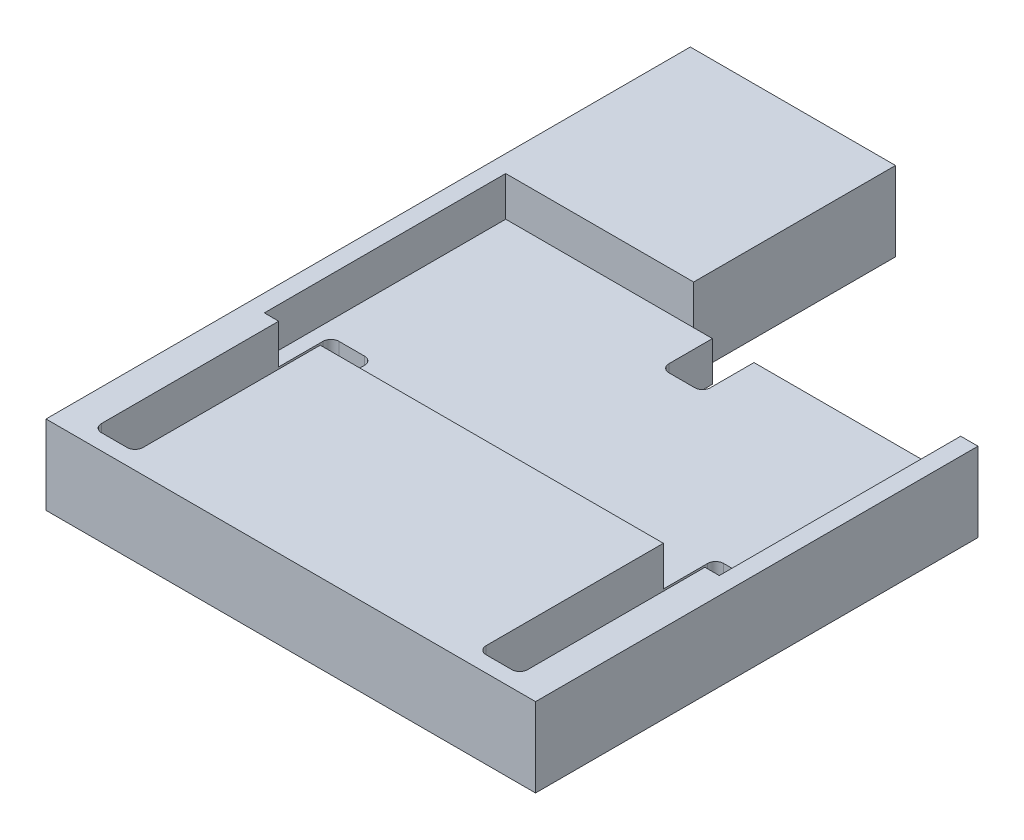
from build123d import *

# Parameters (mm, degrees)
BOSS_EXTRUDE5_DEPTH = 10
CUT_EXTRUDE6_DEPTH  = 5
FILLET4_R           = 1
MIRROR25_DEPTH      = 10
MIRROR25_2_DEPTH    = 5
SKETCH20_W          = 35.925
SKETCH20_H          = 25.502594227
CUT_EXTRUDE7_DEPTH  = 10


# Read off the part's stored shape, not the designer's step: Mirror25
with BuildPart() as part:
    # Sketch15 → Boss-Extrude5 (new body)
    with BuildSketch(Plane(origin=(0, 0, 0), x_dir=(1, 0, 0), z_dir=(0, 1, 0))):
        Polygon((24.3, 76.900659127), (-6.625, 76.900659127), (-6.625, -4.5), (24.3, -4.5), (24.3, 44.900659127), (21.675, 44.900659127), (21.675, 47.400659127), (21.675, 72.400659127), (21.675, 74.900659127), (24.3, 74.900659127), align=None)
        Polygon((-2.625, 25), (-2.625, 0), (-2.625, -2.5), (0, -2.5), (2.625, -2.5), (2.625, 0), (2.625, 25), (2.625, 27.5), (0, 27.5), (-2.625, 27.5), align=None, mode=Mode.SUBTRACT)
    extrude(amount=BOSS_EXTRUDE5_DEPTH)

    # Sketch18 → Cut-Extrude6 (cut)
    with BuildSketch(Plane(origin=(0, 10, 0), x_dir=(1, 0, 0), z_dir=(0, 1, 0))):
        Polygon((21.675, 51.3980649), (-4.44053483, 51.3980649), (-4.44053483, 20.8980649), (24.3, 20.8980649), (24.3, 51.3980649), align=None)
    extrude(amount=-CUT_EXTRUDE6_DEPTH, mode=Mode.SUBTRACT)

    # Fillet4
    fillet4_edges = [part.edges().sort_by_distance(p)[0] for p in [
        (21.675, 5, -74.900659127),
        (-2.625, 5, 2.5),
        (2.625, 5, 2.5),
        (2.625, 2.5, -27.5),
        (-2.625, 2.5, -27.5),
        (21.675, 2.5, -44.900659127),
    ]]
    fillet(fillet4_edges, radius=FILLET4_R)

    # Mirror25 outline → Mirror25 (add)
    with BuildSketch(Plane(origin=(0, 0, 0), x_dir=(1, 0, 0), z_dir=(0, 1, 0))):
        with BuildLine():
            Line((45.975, 20.8980649), (24.3, 20.8980649))
            Line((24.3, 20.8980649), (24.3, -4.5))
            Line((24.3, -4.5), (55.225, -4.5))
            Line((55.225, -4.5), (55.225, 76.900659127))
            Line((55.225, 76.900659127), (24.3, 76.900659127))
            Line((24.3, 76.900659127), (24.3, 74.900659127))
            Line((24.3, 74.900659127), (25.925, 74.900659127))
            ThreePointArc((25.925, 74.900659127), (26.632106781, 74.607765908), (26.925, 73.900659127))
            Line((26.925, 73.900659127), (26.925, 51.3980649))
            Line((26.925, 51.3980649), (53.04053483, 51.3980649))
            Line((53.04053483, 51.3980649), (53.04053483, 20.8980649))
            Line((53.04053483, 20.8980649), (51.225, 20.8980649))
            Line((51.225, 20.8980649), (51.225, -1.5))
            ThreePointArc((51.225, -1.5), (50.932106781, -2.207106781), (50.225, -2.5))
            Line((50.225, -2.5), (46.975, -2.5))
            ThreePointArc((46.975, -2.5), (46.267893219, -2.207106781), (45.975, -1.5))
            Line((45.975, -1.5), (45.975, 20.8980649))
        make_face()
    extrude(amount=MIRROR25_DEPTH)

    # Mirror25 2 outline → Mirror25 2 (add)
    with BuildSketch(Plane(origin=(0, 0, 0), x_dir=(1, 0, 0), z_dir=(0, 1, 0))):
        with BuildLine():
            Line((25.925, 44.900659127), (24.3, 44.900659127))
            Line((24.3, 44.900659127), (24.3, 20.8980649))
            Line((24.3, 20.8980649), (45.975, 20.8980649))
            Line((45.975, 20.8980649), (45.975, 26.5))
            ThreePointArc((45.975, 26.5), (46.267893219, 27.207106781), (46.975, 27.5))
            Line((46.975, 27.5), (50.225, 27.5))
            ThreePointArc((50.225, 27.5), (50.932106781, 27.207106781), (51.225, 26.5))
            Line((51.225, 26.5), (51.225, 20.8980649))
            Line((51.225, 20.8980649), (53.04053483, 20.8980649))
            Line((53.04053483, 20.8980649), (53.04053483, 51.3980649))
            Line((53.04053483, 51.3980649), (26.925, 51.3980649))
            Line((26.925, 51.3980649), (26.925, 45.900659127))
            ThreePointArc((26.925, 45.900659127), (26.632106781, 45.193552346), (25.925, 44.900659127))
        make_face()
    extrude(amount=MIRROR25_2_DEPTH)

    # Sketch20 → Cut-Extrude7 (cut)
    with BuildSketch(Plane(origin=(0, 10, 0), x_dir=(1, 0, 0), z_dir=(0, 1, 0))):
        with Locations((37.2625, 64.149362014)):
            Rectangle(SKETCH20_W, SKETCH20_H)
    extrude(amount=-CUT_EXTRUDE7_DEPTH, mode=Mode.SUBTRACT)


solid = part.part
